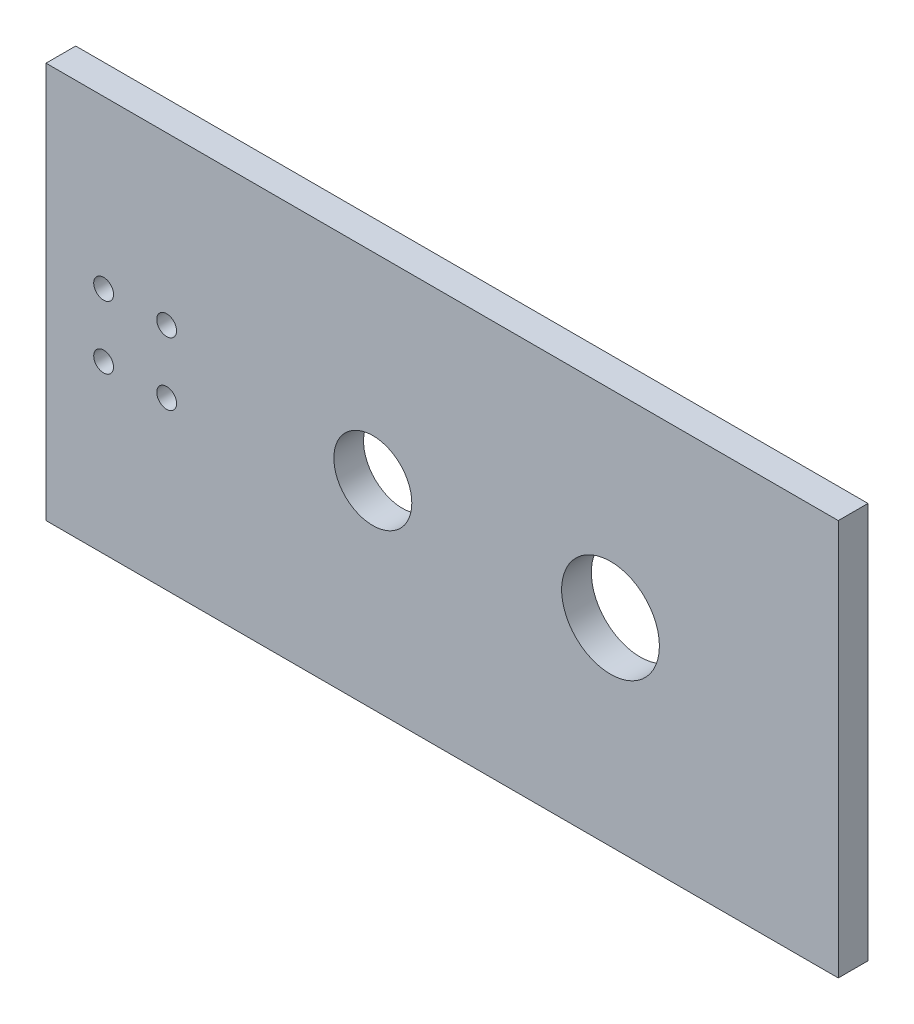
from build123d import *

# Parameters (mm, degrees)
SKETCH1_W           = 80
SKETCH1_H           = 40
BOSS_EXTRUDE1_DEPTH = 3
SKETCH2_R           = 1
CUT_EXTRUDE1_DEPTH  = 90.493016487


with BuildPart() as part:
    # Sketch1 → Boss-Extrude1 (new body)
    with BuildSketch(Plane.XY):
        with Locations((40, 20)):
            Rectangle(SKETCH1_W, SKETCH1_H)
    extrude(amount=BOSS_EXTRUDE1_DEPTH)

    # Sketch2 → Cut-Extrude1 (cut, through all)
    with BuildSketch(Plane.XY.offset(3)):
        with BuildLine():
            ThreePointArc((36.9365, 20), (33, 23.9365), (29.0635, 20))
            Line((29.0635, 20), (36.9365, 20))
        make_face()
        with BuildLine():
            Line((36.9365, 20), (29.0635, 20))
            ThreePointArc((29.0635, 20), (33, 16.0635), (36.9365, 20))
        make_face()
        with BuildLine():
            ThreePointArc((36.9365, 20), (33, 23.9365), (29.0635, 20))
            Line((29.0635, 20), (36.9365, 20))
        make_face()
        with BuildLine():
            Line((36.9365, 20), (29.0635, 20))
            ThreePointArc((29.0635, 20), (33, 16.0635), (36.9365, 20))
        make_face()
        with BuildLine():
            ThreePointArc((61.9365, 20), (57, 24.9365), (52.0635, 20))
            Line((52.0635, 20), (61.9365, 20))
        make_face()
        with BuildLine():
            Line((61.9365, 20), (52.0635, 20))
            ThreePointArc((52.0635, 20), (57, 15.0635), (61.9365, 20))
        make_face()
        with BuildLine():
            ThreePointArc((61.9365, 20), (57, 24.9365), (52.0635, 20))
            Line((52.0635, 20), (61.9365, 20))
        make_face()
        with BuildLine():
            Line((61.9365, 20), (52.0635, 20))
            ThreePointArc((52.0635, 20), (57, 15.0635), (61.9365, 20))
        make_face()
        with Locations((5.818019485, 23.181980515)):
            Circle(SKETCH2_R)
        with Locations((12.181980515, 23.181980515)):
            Circle(SKETCH2_R)
        with Locations((12.181980515, 16.818019485)):
            Circle(SKETCH2_R)
        with Locations((5.818019485, 16.818019485)):
            Circle(SKETCH2_R)
    extrude(amount=-CUT_EXTRUDE1_DEPTH, mode=Mode.SUBTRACT)


solid = part.part
